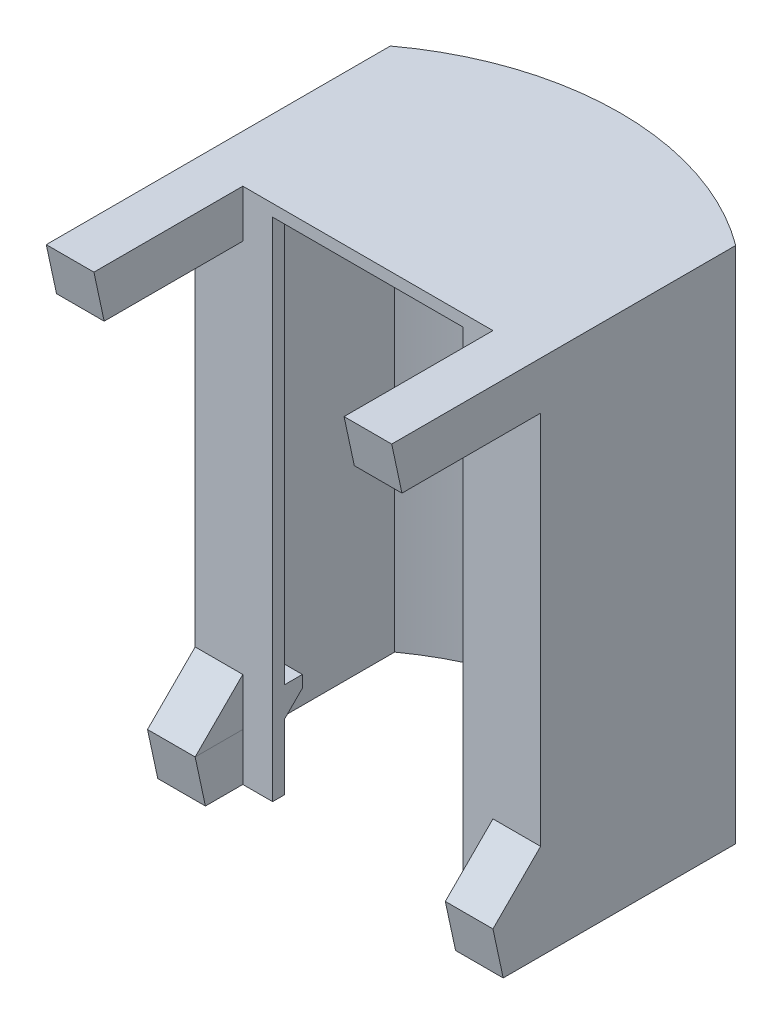
from build123d import *

# Parameters (mm, degrees)
BOSS_EXTRUDE1_DEPTH = 85
BOSS_EXTRUDE3_DEPTH = 2
SKETCH4_W           = 8
SKETCH4_H           = 8
BOSS_EXTRUDE4_DEPTH = 25
SKETCH5_W           = 8
SKETCH5_H           = 8
BOSS_EXTRUDE5_DEPTH = 8
CUT_EXTRUDE1_DEPTH  = 113.680965562
BOSS_EXTRUDE6_DEPTH = 8
BOSS_EXTRUDE7_DEPTH = 8
SKETCH9_W           = 11.5
SKETCH9_H           = 2
BOSS_EXTRUDE8_DEPTH = 3
CHAMFER1_SIZE       = 3


with BuildPart() as part:
    # Sketch1 → Boss-Extrude1 (new body)
    with BuildSketch(Plane(origin=(0, 0, 0), x_dir=(1, 0, 0), z_dir=(0, 1, 0))):
        with BuildLine():
            Line((-29, -15), (-29, 15.762564303))
            ThreePointArc((-29, 15.762564303), (0, 25.341269657), (29, 15.762564303))
            Line((29, 15.762564303), (29, -15))
            Line((29, -15), (29, -17))
            Line((29, -17), (27.5, -17))
            Line((27.5, -17), (16, -17))
            Line((16, -17), (16, -15))
            Line((16, -15), (27.5, -15))
            Line((27.5, -15), (27.5, 15))
            ThreePointArc((27.5, 15), (0, 23.841269657), (-27.5, 15))
            Line((-27.5, 15), (-27.5, -15))
            Line((-27.5, -15), (-16, -15))
            Line((-16, -15), (-16, -17))
            Line((-16, -17), (-27.5, -17))
            Line((-27.5, -17), (-29, -17))
            Line((-29, -17), (-29, -15))
        make_face()
    extrude(amount=BOSS_EXTRUDE1_DEPTH)

    # Sketch3 → Boss-Extrude3 (add)
    with BuildSketch(Plane(origin=(0, 85, 0), x_dir=(1, 0, 0), z_dir=(0, 1, 0))):
        with BuildLine():
            Line((-16, -17), (16, -17))
            Line((16, -17), (29, -17))
            Line((29, -17), (29, 15.762564303))
            ThreePointArc((29, 15.762564303), (0, 25.341269657), (-29, 15.762564303))
            Line((-29, 15.762564303), (-29, -17))
            Line((-29, -17), (-16, -17))
        make_face()
    extrude(amount=BOSS_EXTRUDE3_DEPTH)

    # Sketch4 → Boss-Extrude4 (add)
    with BuildSketch(Plane.XY.offset(17)):
        with Locations((-25, 83)):
            Rectangle(SKETCH4_W, SKETCH4_H)
        with Locations((25, 83)):
            Rectangle(SKETCH4_W, SKETCH4_H)
    extrude(amount=BOSS_EXTRUDE4_DEPTH)

    # Sketch5 → Boss-Extrude5 (add)
    with BuildSketch(Plane.XY.offset(17)):
        with Locations((-25, 4)):
            Rectangle(SKETCH5_W, SKETCH5_H)
        with Locations((25, 4)):
            Rectangle(SKETCH5_W, SKETCH5_H)
    extrude(amount=BOSS_EXTRUDE5_DEPTH)

    # Sketch6 → Cut-Extrude1 (cut, through all)
    with BuildSketch(Plane(origin=(29, 0, 0), x_dir=(0, 0, -1), z_dir=(1, 0, 0))):
        Polygon((-42, 87), (-25, 8), (-22.532486397, -3.466680862), (-79.892152399, -33.861041242), (-91.286550285, 63.092144643), (-70.491971044, 113.237202283), (-29.556352235, 113.237202283), align=None)
    extrude(amount=-CUT_EXTRUDE1_DEPTH, mode=Mode.SUBTRACT)

    # Sketch7 → Boss-Extrude6 (add)
    with BuildSketch(Plane(origin=(29, 0, 0), x_dir=(0, 0, -1), z_dir=(1, 0, 0))):
        Polygon((-25, 8), (-17, 16), (-17, 8), align=None)
    extrude(amount=-BOSS_EXTRUDE6_DEPTH)

    # Sketch9 → Boss-Extrude8 (add)
    with BuildSketch(Plane(origin=(0, 0, 15), x_dir=(-1, 0, 0), z_dir=(0, 0, -1))):
        with Locations((-21.75, 15)):
            Rectangle(SKETCH9_W, SKETCH9_H)
        with Locations((21.75, 15)):
            Rectangle(SKETCH9_W, SKETCH9_H)
    extrude(amount=BOSS_EXTRUDE8_DEPTH)

    # Chamfer1
    chamfer1_edges = [part.edges().sort_by_distance(p)[0] for p in [
        (-21.75, 14, 15),
        (21.75, 14, 15),
    ]]
    chamfer(chamfer1_edges, length=CHAMFER1_SIZE - 0.0001)  # a hair under: the kernel refuses the full size


with BuildPart() as body_2:
    # Sketch8 → Boss-Extrude7 (new body)
    with BuildSketch(Plane.ZY.offset(29)):
        Polygon((25, 8), (17, 16), (17, 8), align=None)
    extrude(amount=-BOSS_EXTRUDE7_DEPTH)


solid = Compound([part.part, body_2.part])
